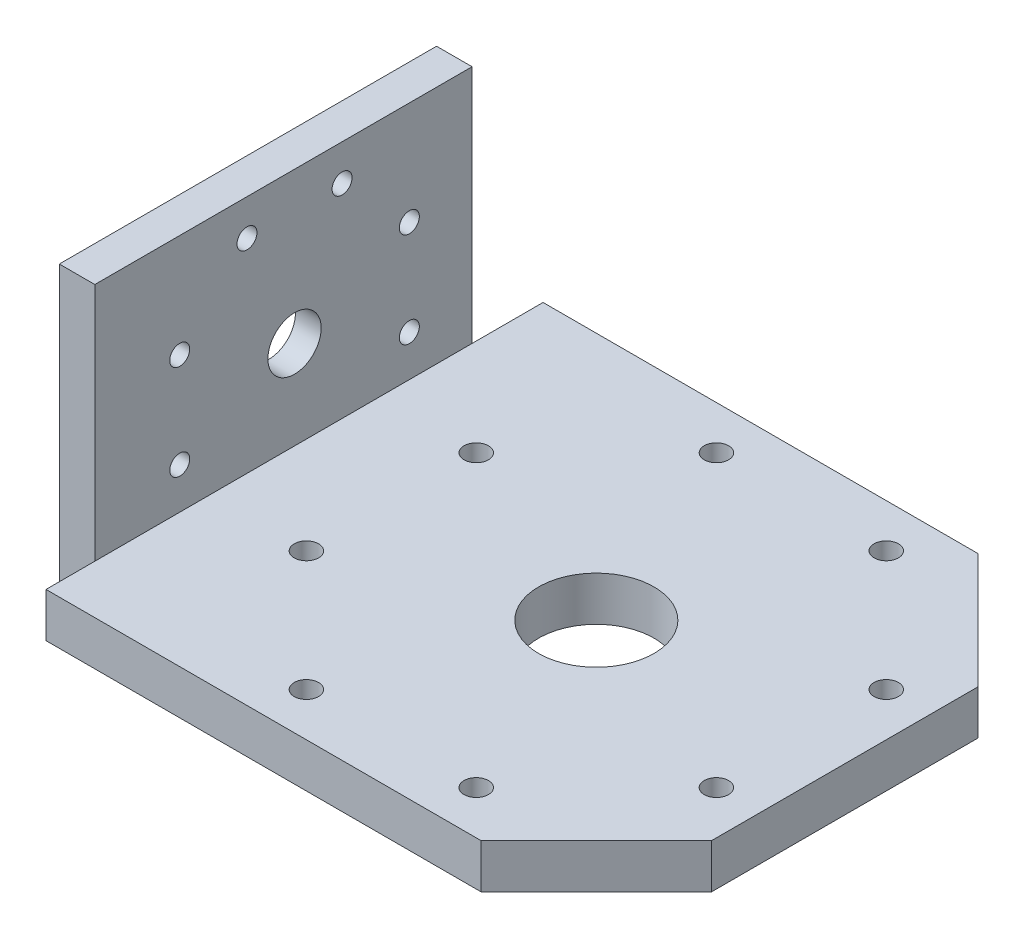
from build123d import *

# Parameters (mm, degrees)
SK_BACK_PLATE_W         = 85
SK_BACK_PLATE_H         = 70
SK_BACK_PLATE_R         = 2.25
SK_BACK_PLATE_R_2       = 6
BACK_PLATE_DEPTH        = 8
SK_ROLL_PILOT_RECESS_R  = 22.15
ROLL_PILOT_RECESS_DEPTH = 2.2
SK_MEDIAL_PLATE_R       = 2.75
SK_MEDIAL_PLATE_R_2     = 13
MEDIAL_PLATE_DEPTH      = 10


with BuildPart() as part:
    # SK_Back_Plate → Back_Plate (new body)
    with BuildSketch(Plane(origin=(-76, 0, 0), x_dir=(0, 0, -1), z_dir=(1, 0, 0))):
        with Locations((-2.5, -1)):
            Rectangle(SK_BACK_PLATE_W, SK_BACK_PLATE_H)
        with Locations((25.86862691, 10.715136106)):
            Circle(SK_BACK_PLATE_R, mode=Mode.SUBTRACT)
        with Locations((10.715136106, 25.86862691)):
            Circle(SK_BACK_PLATE_R, mode=Mode.SUBTRACT)
        with Locations((-10.715136106, 25.86862691)):
            Circle(SK_BACK_PLATE_R, mode=Mode.SUBTRACT)
        with Locations((-25.86862691, 10.715136106)):
            Circle(SK_BACK_PLATE_R, mode=Mode.SUBTRACT)
        with Locations((-25.86862691, -10.715136106)):
            Circle(SK_BACK_PLATE_R, mode=Mode.SUBTRACT)
        with Locations((-10.715136106, -25.86862691)):
            Circle(SK_BACK_PLATE_R, mode=Mode.SUBTRACT)
        with Locations((10.715136106, -25.86862691)):
            Circle(SK_BACK_PLATE_R, mode=Mode.SUBTRACT)
        with Locations((25.86862691, -10.715136106)):
            Circle(SK_BACK_PLATE_R, mode=Mode.SUBTRACT)
        Circle(SK_BACK_PLATE_R_2, mode=Mode.SUBTRACT)
    extrude(amount=BACK_PLATE_DEPTH)

    # SK_Roll_Pilot_Recess → Roll_Pilot_Recess (cut)
    with BuildSketch(Plane(origin=(-76, 0, 0), x_dir=(0, 0, -1), z_dir=(1, 0, 0))):
        Circle(SK_ROLL_PILOT_RECESS_R)
    extrude(amount=ROLL_PILOT_RECESS_DEPTH, mode=Mode.SUBTRACT)

    # SK_Medial_Plate → Medial_Plate (add)
    with BuildSketch(Plane(origin=(0, -30, 0), x_dir=(1, 0, 0), z_dir=(0, 1, 0))):
        Polygon((-68, 56), (30, 56), (56, 30), (56, -30), (30, -56), (-68, -56), align=None)
        with Locations((46.193976626, 19.134171618)):
            Circle(SK_MEDIAL_PLATE_R, mode=Mode.SUBTRACT)
        with Locations((19.134171618, 46.193976626)):
            Circle(SK_MEDIAL_PLATE_R, mode=Mode.SUBTRACT)
        with Locations((-19.134171618, 46.193976626)):
            Circle(SK_MEDIAL_PLATE_R, mode=Mode.SUBTRACT)
        with Locations((-46.193976626, 19.134171618)):
            Circle(SK_MEDIAL_PLATE_R, mode=Mode.SUBTRACT)
        with Locations((-46.193976626, -19.134171618)):
            Circle(SK_MEDIAL_PLATE_R, mode=Mode.SUBTRACT)
        with Locations((-19.134171618, -46.193976626)):
            Circle(SK_MEDIAL_PLATE_R, mode=Mode.SUBTRACT)
        with Locations((19.134171618, -46.193976626)):
            Circle(SK_MEDIAL_PLATE_R, mode=Mode.SUBTRACT)
        with Locations((46.193976626, -19.134171618)):
            Circle(SK_MEDIAL_PLATE_R, mode=Mode.SUBTRACT)
        Circle(SK_MEDIAL_PLATE_R_2, mode=Mode.SUBTRACT)
    extrude(amount=MEDIAL_PLATE_DEPTH)


solid = part.part
